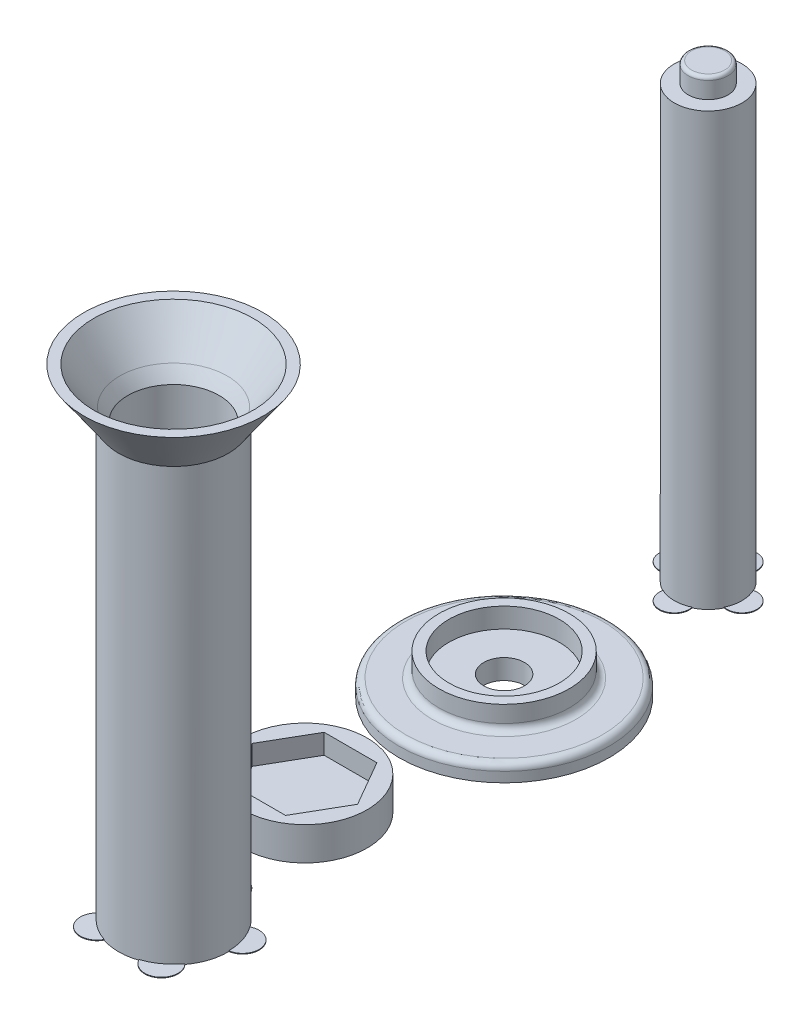
from build123d import *

# Parameters (mm, degrees)
SKETCH1_R             = 16.63
BOSS_EXTRUDE1_DEPTH   = 6
SKETCH1_3_R           = 19.63
SKETCH1_3_R_2         = 16.63
BOSS_EXTRUDE2_DEPTH   = 12
SKETCH1_4_R           = 31.63
SKETCH1_4_R_2         = 19.63
BOSS_EXTRUDE3_DEPTH   = 5
FILLET1_R             = 2
SKETCH2_R             = 16.499999999999993
SKETCH2_R_2           = 13.75
BOSS_EXTRUDE4_DEPTH   = 130
SKETCH3_R             = 6.125
CUT_EXTRUDE1_DEPTH    = 100
SKETCH4_R             = 10.19999999999999
BOSS_EXTRUDE5_DEPTH   = 130.00000000000003
SKETCH4_3_R           = 5.999999999999995
BOSS_EXTRUDE6_DEPTH   = 6
FILLET3_R             = 1
BODY_MOVE_COPY1_ANGLE = 180
BOSS_EXTRUDE7_DEPTH   = 0.2
SKETCH6_R             = 4.499999999999998
SKETCH6_R_2           = 10.19999999999999
SKETCH6_R_3           = 4.500000000000004
SKETCH6_R_4           = 10.200000000000001
SKETCH6_R_5           = 4.500000000000005
BOSS_EXTRUDE8_DEPTH   = 0.2
FILLET4_R             = 51
SKETCH11_R            = 18.750000000000004
BOSS_EXTRUDE11_DEPTH  = 4
SKETCH11_3_R          = 18.750000000000004
BOSS_EXTRUDE12_DEPTH  = 10


with BuildPart() as part:
    # Sketch1 → Boss-Extrude1 (new body)
    with BuildSketch(Plane(origin=(0, 0, 0), x_dir=(1, 0, 0), z_dir=(0, 1, 0))):
        with Locations(Location((0, 0, 0), (0, 0, 270))):
            Circle(SKETCH1_R)
    extrude(amount=BOSS_EXTRUDE1_DEPTH)

    # Sketch1<3> → Boss-Extrude2 (add)
    with BuildSketch(Plane(origin=(0, 0, 0), x_dir=(1, 0, 0), z_dir=(0, 1, 0))):
        with Locations(Location((0, 0, 0), (0, 0, 270))):
            Circle(SKETCH1_3_R)
        with Locations(Location((0, 0, 0), (0, 0, 270))):
            Circle(SKETCH1_3_R_2, mode=Mode.SUBTRACT)
    extrude(amount=BOSS_EXTRUDE2_DEPTH)

    # Sketch1<4> → Boss-Extrude3 (add)
    with BuildSketch(Plane(origin=(0, 0, 0), x_dir=(1, 0, 0), z_dir=(0, 1, 0))):
        with Locations(Location((0, 0, 0), (0, 0, 270))):
            Circle(SKETCH1_4_R)
        with Locations(Location((0, 0, 0), (0, 0, 270))):
            Circle(SKETCH1_4_R_2, mode=Mode.SUBTRACT)
    extrude(amount=BOSS_EXTRUDE3_DEPTH)

    # Fillet1
    fillet1_edges = [part.edges().sort_by_distance(p)[0] for p in [
        (6.01e-15, 5, -19.63),
        (9.68e-15, 5, -31.63),
    ]]
    fillet(fillet1_edges, radius=FILLET1_R)

    # Sketch3 → Cut-Extrude1 (cut)
    with BuildSketch(Plane(origin=(0, 6, 0), x_dir=(1, 0, 0), z_dir=(0, 1, 0))):
        with Locations(Location((0, 0, 0), (0, 0, 270))):
            Circle(SKETCH3_R)
    extrude(amount=-CUT_EXTRUDE1_DEPTH, mode=Mode.SUBTRACT)


with BuildPart() as body_2:
    # Sketch2 → Boss-Extrude4 (new body)
    with BuildSketch(Plane(origin=(0, 0, 0), x_dir=(1, 0, 0), z_dir=(0, 1, 0))):
        with Locations(Location((60, 0, 0), (0, 0, 270))):
            Circle(SKETCH2_R)
        with Locations(Location((60, 0, 0), (0, 0, 270))):
            Circle(SKETCH2_R_2, mode=Mode.SUBTRACT)
    extrude(amount=BOSS_EXTRUDE4_DEPTH)

    # Sketch5 → Boss-Extrude7 (add)
    with BuildSketch(Plane.XZ):
        with BuildLine():
            ThreePointArc((65.25478060139801, 15.640884912023708), (69.69845666282565, 13.348780407186739), (73.25154900865867, 9.830892577539284))
            ThreePointArc((73.25154900865891, 9.830892577539114), (72.6373829242881, 17.393865379061403), (65.25478060139807, 15.640884912023665))
        make_face()
        with BuildLine():
            ThreePointArc((73.44468829233415, -9.565059159355442), (80.44771510034582, -6.643865379061353), (76.49918202374636, -0.16429408778297105))
            ThreePointArc((76.4991820237465, -0.16429408778252608), (75.69243251887004, -5.0987804071865925), (73.444688292334, -9.565059159355814))
        make_face()
        with BuildLine():
            ThreePointArc((46.74845099134144, 9.83089257753945), (50.30154333717442, 13.348780407186792), (54.74521939860196, 15.640884912023699))
            ThreePointArc((54.74521939860191, 15.640884912023663), (47.3626170757119, 17.393865379061413), (46.74845099134104, 9.830892577539155))
        make_face()
        with BuildLine():
            ThreePointArc((55.05772532415149, -15.74242424242421), (60, -21.499999999999996), (64.94227467584851, -15.742424242424214))
            ThreePointArc((64.94227467584858, -15.742424242424216), (60, -16.499999999999993), (55.057725324151406, -15.74242424242421))
        make_face()
        with BuildLine():
            ThreePointArc((46.55531170766575, -9.565059159355473), (44.30756748112995, -5.098780407186559), (43.50081797625351, -0.1642940877828717))
            ThreePointArc((43.50081797625355, -0.16429408778300125), (39.55228489965419, -6.643865379061347), (46.555311707665744, -9.565059159355496))
        make_face()
    extrude(amount=-BOSS_EXTRUDE7_DEPTH)

    # Sketch10 → Revolve1 (revolve)
    with BuildSketch(Plane.XY, mode=Mode.PRIVATE) as revolve1_sk:
        Polygon((43.50000000000001, 130), (32.99688692685439, 145.00000000000003), (35.996886926854394, 145.00000000000003), (46.50000000000001, 130), align=None)
    revolve(revolve1_sk.sketch.rotate(Axis((60, 130, 0), (0, -1, 0)), 270), axis=Axis((60, 130, 0), (0, -1, 0)))

    # Fillet4
    # the kernel refuses this fillet: 51 mm, written as the material it takes off along each edge
    with BuildSketch(Plane(origin=(60, 130, 0), x_dir=(5.3e-16, 0, 1), z_dir=(1, 0, -5.3e-16))) as fillet4_piece_1:
        with BuildLine():
            CenterArc((57.97783134059824, 25.39486040338865), FILLET4_R, 209.8637017104066, 5.136298289593242)
            Line((13.75, 0), (13.499999999999993, 0))
            Line((13.499999999999993, 0), (16.201077081859587, -3.8575378505146034))
        make_face()
    revolve(axis=Axis((60, 130, 0), (0, -1, 0)), mode=Mode.SUBTRACT)


with BuildPart() as body_3:
    # Sketch4 → Boss-Extrude5 (new body)
    with BuildSketch(Plane(origin=(0, 0, 0), x_dir=(1, 0, 0), z_dir=(0, 1, 0))):
        with Locations(Location((55, 0, 0), (0, 0, 270))):
            Circle(SKETCH4_R)
    extrude(amount=BOSS_EXTRUDE5_DEPTH)

    # Sketch4<3> → Boss-Extrude6 (add)
    with BuildSketch(Plane(origin=(0, 0, 0), x_dir=(1, 0, 0), z_dir=(0, 1, 0))):
        with Locations(Location((55, 0, 0), (0, 0, 270))):
            Circle(SKETCH4_3_R)
    extrude(amount=-BOSS_EXTRUDE6_DEPTH)

    # Fillet3
    fillet3_edges = [body_3.edges().sort_by_distance(p)[0] for p in [
        (55, -6, -5.999999999999995),
    ]]
    fillet(fillet3_edges, radius=FILLET3_R)


with BuildPart() as body_3_1:
    # Body-Move/Copy1: read off the stored shape, not the designer's step
    # Body-Move/Copy1: moved
    add(body_3.part.moved(Location((0, -130, 0))).rotate(Axis((0, 0, 0), (0.2853339234, 0, -0.9584281675)), BODY_MOVE_COPY1_ANGLE))

    # Sketch6 → Boss-Extrude8 (add)
    with BuildSketch(Plane.XZ):
        with Locations((-46.04430073821723, -19.881927623219386)):
            Circle(SKETCH6_R)
        with Locations(Location((-46.04430073821723, -30.08192762321938, 0), (0, 0, 295.487170444))):
            Circle(SKETCH6_R_2)
        with Locations((-35.84430073821724, -30.08192762321938)):
            Circle(SKETCH6_R_3)
        with Locations(Location((-46.04430073821723, -30.08192762321938, 0), (0, 0, 295.487170444))):
            Circle(SKETCH6_R_2)
        with Locations(Location((-46.04430073821723, -30.08192762321938, 0), (0, 0, 295.487170444))):
            Circle(SKETCH6_R_4)
        with Locations((-46.04430073821723, -40.281927623219374)):
            Circle(SKETCH6_R_5)
        with Locations(Location((-46.04430073821723, -30.08192762321938, 0), (0, 0, 295.487170444))):
            Circle(SKETCH6_R_4)
        with Locations((-56.24430073821722, -30.081927623219375)):
            Circle(SKETCH6_R)
    extrude(amount=-BOSS_EXTRUDE8_DEPTH)


with BuildPart() as body_4:
    # Sketch11 → Boss-Extrude11 (new body)
    # profile 1 of 2: a face of its own
    with BuildSketch(Plane(origin=(0, 0, 0), x_dir=(1, 0, 0), z_dir=(0, 1, 0))):
        with Locations(Location((0, -60, 0), (0, 0, 270))):
            Circle(SKETCH11_R)
        Polygon((-7.938566201357354, -73.75), (7.938566201357352, -73.75), (15.877132402714707, -59.99999999999999), (7.93856620135735, -46.24999999999999), (-7.938566201357352, -46.24999999999999), (-15.877132402714711, -60), align=None, mode=Mode.SUBTRACT)
    # profile 2 of 2: a face of its own
    with BuildSketch(Plane(origin=(0, 0, 0), x_dir=(1, 0, 0), z_dir=(0, 1, 0))):
        Polygon((-15.877132402714711, -60), (-7.938566201357354, -73.75), (7.938566201357352, -73.75), (15.877132402714707, -59.99999999999999), (7.93856620135735, -46.24999999999999), (-7.938566201357352, -46.24999999999999), align=None)
    extrude(amount=BOSS_EXTRUDE11_DEPTH)

    # Sketch11<3> → Boss-Extrude12 (add)
    with BuildSketch(Plane(origin=(0, 0, 0), x_dir=(1, 0, 0), z_dir=(0, 1, 0))):
        with Locations(Location((0, -60, 0), (0, 0, 270))):
            Circle(SKETCH11_3_R)
        Polygon((7.938566201357352, -73.75), (15.877132402714707, -59.99999999999999), (7.93856620135735, -46.24999999999999), (-7.938566201357352, -46.24999999999999), (-15.877132402714711, -60), (-7.938566201357354, -73.75), align=None, mode=Mode.SUBTRACT)
    extrude(amount=BOSS_EXTRUDE12_DEPTH)


with BuildPart() as body_3_2:
    # Body-Move/Copy3: moved
    add(body_3_1.part.moved(Location((46.70654023283633, 0, -30.700759974247646))))


with BuildPart() as body_2_1:
    # Body-Move/Copy4: moved
    add(body_2.part.moved(Location((-51.58952146507627, 0, 107.95642508673633))))


solid = Compound([part.part, body_4.part, body_3_2.part, body_2_1.part])
